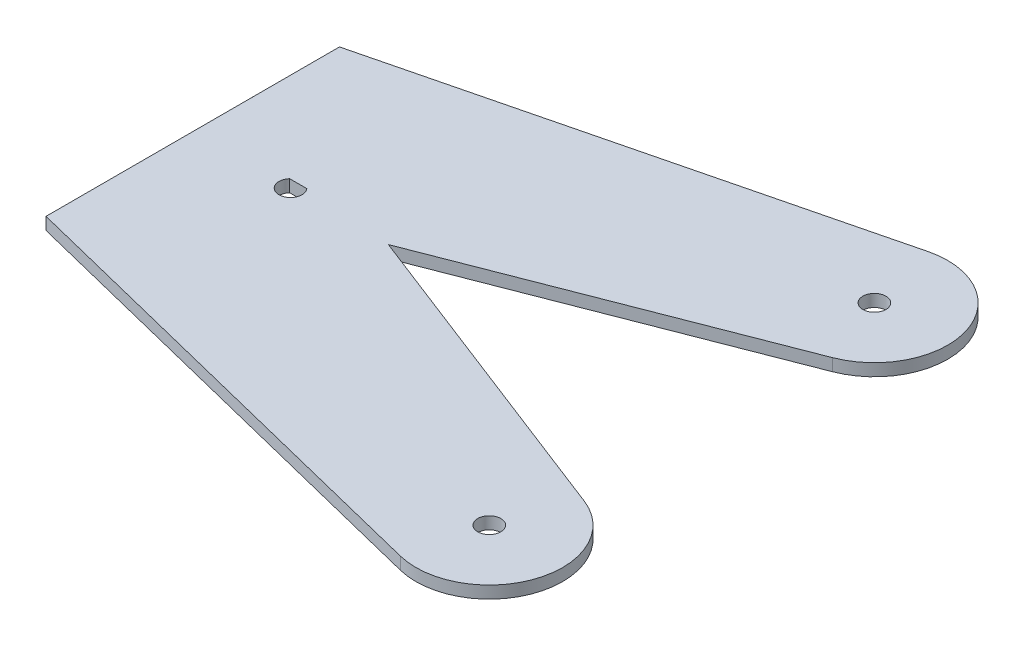
from build123d import *

# Parameters (mm, degrees)
SKETCH1_R           = 3
BOSS_EXTRUDE1_DEPTH = 1.5875


with BuildPart() as part:
    # Sketch1 → Boss-Extrude1 (new, symmetric)
    with BuildSketch(Plane(origin=(0, 0, 0), x_dir=(1, 0, 0), z_dir=(0, 1, 0))):
        with BuildLine():
            Line((-25.4, 38.1), (97.010086235, 68.488785564))
            ThreePointArc((97.010086235, 68.488785564), (119.760857484, 55.752021858), (108.491020074, 32.240035407))
            Line((108.491020074, 32.240035407), (25.4, 0))
            Line((25.4, 0), (108.491020074, -32.240035407))
            ThreePointArc((108.491020074, -32.240035407), (119.760857484, -55.752021858), (97.010086235, -68.488785564))
            Line((97.010086235, -68.488785564), (-25.4, -38.1))
            Line((-25.4, -38.1), (-25.4, 38.1))
        make_face()
        with Locations((101.6, 50)):
            Circle(SKETCH1_R, mode=Mode.SUBTRACT)
        with Locations((101.6, -50)):
            Circle(SKETCH1_R, mode=Mode.SUBTRACT)
        with BuildLine():
            Line((-2.236067977, 2), (2.236067977, 2))
            ThreePointArc((2.236067977, 2), (0, -3), (-2.236067977, 2))
        make_face(mode=Mode.SUBTRACT)
    extrude(amount=BOSS_EXTRUDE1_DEPTH, both=True)


solid = part.part
